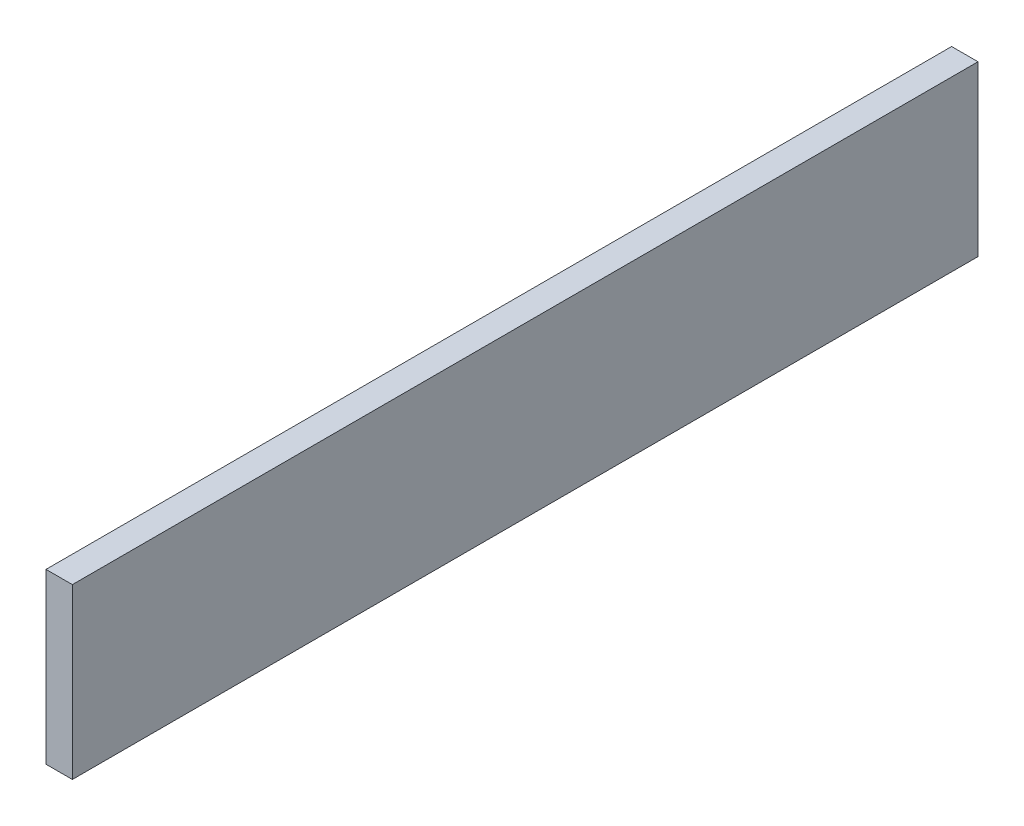
from build123d import *

# Parameters (mm, degrees)
BOSS_EXTRUDE1_START = 50
SKETCH1_W           = 32
SKETCH1_H           = 171.704
BOSS_EXTRUDE1_DEPTH = 5


with BuildPart() as part:
    # Sketch1 → Boss-Extrude1 (new body)
    with BuildSketch(Plane.YZ.offset(BOSS_EXTRUDE1_START)):
        with Locations((-784.1, 3076.448)):
            Rectangle(SKETCH1_W, SKETCH1_H)
    extrude(amount=BOSS_EXTRUDE1_DEPTH)


solid = part.part
